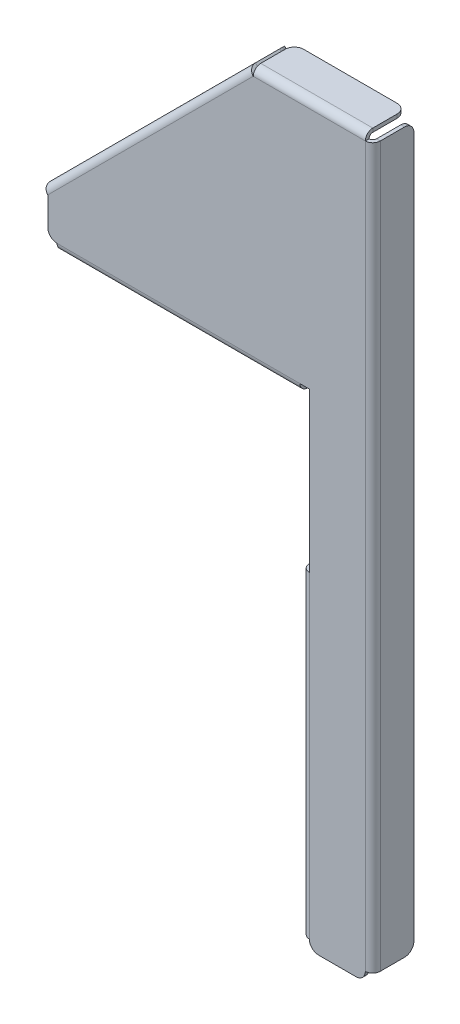
from build123d import *

# Parameters (mm, degrees)
BASE_FLANGE1_DEPTH    = 1
EDGE_FLANGE2_DEPTH    = 85
EDGE_FLANGE3_DEPTH    = 192.5
EDGE_FLANGE1_DEPTH    = 65
EDGE_FLANGE4_DEPTH    = 77.781745931
EDGE_FLANGE5_DEPTH    = 30
BREAK_CORNER1_START   = 128
BREAK_CORNER1_DEPTH   = 69
BREAK_CORNER1_START_2 = 196
BREAK_CORNER1_2_DEPTH = 1
BREAK_CORNER1_START_3 = -150.492424049
BREAK_CORNER1_3_DEPTH = 1
BREAK_CORNER1_START_4 = -2
BREAK_CORNER1_4_DEPTH = 19
BREAK_CORNER1_START_5 = 16
BREAK_CORNER1_5_DEPTH = 1
BREAK_CORNER1_6_DEPTH = 1
BREAK_CORNER1_START_6 = -1
BREAK_CORNER1_7_DEPTH = 1
CUT_EXTRUDE1_REACH    = 150.327


# Read off the part's stored shape, not the designer's step: Break-Corner1
# Sheet-metal steps are written as plain solids
with BuildPart() as part:
    # Sketch1 → Base-Flange1 (new body)
    with BuildSketch(Plane.XY):
        Polygon((0, 130), (-70, 130), (-70, 140), (-15, 195), (15, 195), (15, 130), (15, 0), (0, 0), align=None)
    extrude(amount=-BASE_FLANGE1_DEPTH)

    # Edge-Flange2 section (across the edge) → Edge-Flange2 (add)
    with BuildSketch(Plane(origin=(-1, 2.5, -1), x_dir=(1, 0, 0), z_dir=(0, 1, 0))):
        with BuildLine():
            Line((-1, 1), (-1, 12))
            Line((-1, 12), (0, 12))
            Line((0, 12), (0, 1))
            ThreePointArc((0, 1), (0.292893219, 0.292893219), (1, 0))
            Line((1, 0), (1, -1))
            ThreePointArc((1, -1), (-0.414213562, -0.414213562), (-1, 1))
        make_face()
    extrude(amount=EDGE_FLANGE2_DEPTH)

    # Edge-Flange3 section (across the edge) → Edge-Flange3 (add)
    with BuildSketch(Plane(origin=(16, 195, -1), x_dir=(-1, 0, 0), z_dir=(0, -1, 0))):
        with BuildLine():
            Line((-1, 1), (-1, 10))
            Line((-1, 10), (0, 10))
            Line((0, 10), (0, 1))
            ThreePointArc((0, 1), (0.292893219, 0.292893219), (1, 0))
            Line((1, 0), (1, -1))
            ThreePointArc((1, -1), (-0.414213562, -0.414213562), (-1, 1))
        make_face()
    extrude(amount=EDGE_FLANGE3_DEPTH)

    # Edge-Flange1 section (across the edge) → Edge-Flange1 (add)
    with BuildSketch(Plane(origin=(-2.5, 129, -1), x_dir=(0, 1, 0), z_dir=(-1, 0, 0))):
        with BuildLine():
            Line((-1, 1), (-1, 15.122069622))
            Line((-1, 15.122069622), (0, 15.122069622))
            Line((0, 15.122069622), (0, 1))
            ThreePointArc((0, 1), (0.292893219, 0.292893219), (1, 0))
            Line((1, 0), (1, -1))
            ThreePointArc((1, -1), (-0.414213562, -0.414213562), (-1, 1))
        make_face()
    extrude(amount=EDGE_FLANGE1_DEPTH)

    # Edge-Flange4 section (across the edge) → Edge-Flange4 (add)
    with BuildSketch(Plane(origin=(-70.707106781, 140.707106781, -1), x_dir=(0.7071067811865439, -0.7071067811865512, -3.4914813388431337e-15), z_dir=(0.7071067811865512, 0.7071067811865439, 0))):
        with BuildLine():
            Line((-1, 1), (-1, 10))
            Line((-1, 10), (0, 10))
            Line((0, 10), (0, 1))
            ThreePointArc((0, 1), (0.292893219, 0.292893219), (1, 0))
            Line((1, 0), (1, -1))
            ThreePointArc((1, -1), (-0.414213562, -0.414213562), (-1, 1))
        make_face()
    extrude(amount=EDGE_FLANGE4_DEPTH)

    # Edge-Flange5 section (across the edge) → Edge-Flange5 (add)
    with BuildSketch(Plane(origin=(-15, 196, -1), x_dir=(0, -1, 0), z_dir=(1, 0, 0))):
        with BuildLine():
            Line((-1, 1), (-1, 10))
            Line((-1, 10), (0, 10))
            Line((0, 10), (0, 1))
            ThreePointArc((0, 1), (0.292893219, 0.292893219), (1, 0))
            Line((1, 0), (1, -1))
            ThreePointArc((1, -1), (-0.414213562, -0.414213562), (-1, 1))
        make_face()
    extrude(amount=EDGE_FLANGE5_DEPTH)

    # Break-Corner1 outline → Break-Corner1 (cut)
    with BuildSketch(Plane(origin=(0, 0, 0), x_dir=(1, 0, 0), z_dir=(0, 1, 0)).offset(BREAK_CORNER1_START)):
        with BuildLine():
            ThreePointArc((-67.5, 13.622069622), (-66.767766953, 15.389836575), (-65, 16.122069622))
            Line((-65, 16.122069622), (-67.5, 16.122069622))
            Line((-67.5, 16.122069622), (-67.5, 13.622069622))
        make_face()
        with BuildLine():
            ThreePointArc((-5, 16.122069622), (-3.232233047, 15.389836575), (-2.5, 13.622069622))
            Line((-2.5, 13.622069622), (-2.5, 16.122069622))
            Line((-2.5, 16.122069622), (-5, 16.122069622))
        make_face()
        with BuildLine():
            Line((15, 11), (12.5, 11))
            ThreePointArc((12.5, 11), (14.267766953, 10.267766953), (15, 8.5))
            Line((15, 8.5), (15, 11))
        make_face()
    extrude(amount=BREAK_CORNER1_DEPTH, mode=Mode.SUBTRACT)

    # Break-Corner1 2 outline → Break-Corner1 2 (cut)
    with BuildSketch(Plane(origin=(0, 0, 0), x_dir=(1, 0, 0), z_dir=(0, 1, 0)).offset(BREAK_CORNER1_START_2)):
        with BuildLine():
            Line((-15, 11), (-15, 8.5))
            ThreePointArc((-15, 8.5), (-14.267766953, 10.267766953), (-12.5, 11))
            Line((-12.5, 11), (-15, 11))
        make_face()
    extrude(amount=BREAK_CORNER1_2_DEPTH, mode=Mode.SUBTRACT)

    # Break-Corner1 3 outline → Break-Corner1 3 (cut)
    with BuildSketch(Plane(origin=(0, 0, 0), x_dir=(0.7071067811865509, 0.707106781186544, 0), z_dir=(0.707106781186544, -0.707106781186551, 0)).offset(BREAK_CORNER1_START_3)):
        with BuildLine():
            Line((49.497474683, -11), (51.997474683, -11))
            ThreePointArc((51.997474683, -11), (50.22970773, -10.267766953), (49.497474683, -8.5))
            Line((49.497474683, -8.5), (49.497474683, -11))
        make_face()
        with BuildLine():
            ThreePointArc((127.279220614, -8.5), (126.546987567, -10.267766953), (124.779220614, -11))
            Line((124.779220614, -11), (127.279220614, -11))
            Line((127.279220614, -11), (127.279220614, -8.5))
        make_face()
    extrude(amount=BREAK_CORNER1_3_DEPTH, mode=Mode.SUBTRACT)

    # Break-Corner1 4 outline → Break-Corner1 4 (cut)
    with BuildSketch(Plane.YZ.offset(BREAK_CORNER1_START_4)):
        with BuildLine():
            ThreePointArc((195, -8.5), (194.267766953, -10.267766953), (192.5, -11))
            Line((192.5, -11), (195, -11))
            Line((195, -11), (195, -8.5))
        make_face()
        with BuildLine():
            ThreePointArc((87.449489743, -11), (86.58113883, -12.436491673), (85, -13))
            Line((85, -13), (87.5, -13))
            Line((87.5, -13), (87.5, -11))
            Line((87.5, -11), (87.449489743, -11))
        make_face()
        with BuildLine():
            Line((2.5, -13), (5, -13))
            ThreePointArc((5, -13), (3.232233047, -12.267766953), (2.5, -10.5))
            Line((2.5, -10.5), (2.5, -13))
        make_face()
    extrude(amount=BREAK_CORNER1_4_DEPTH, mode=Mode.SUBTRACT)

    # Break-Corner1 5 outline → Break-Corner1 5 (cut)
    with BuildSketch(Plane.YZ.offset(BREAK_CORNER1_START_5)):
        with BuildLine():
            Line((2.550510257, -11), (5, -11))
            ThreePointArc((5, -11), (3.232233047, -10.267766953), (2.5, -8.5))
            Line((2.5, -8.5), (2.5, -10.5))
            ThreePointArc((2.5, -10.5), (2.512659617, -10.751272405), (2.550510257, -11))
        make_face()
    extrude(amount=BREAK_CORNER1_5_DEPTH, mode=Mode.SUBTRACT)

    # Break-Corner1 6 outline → Break-Corner1 6 (cut)
    with BuildSketch(Plane.YZ.offset(BREAK_CORNER1_START_4)):
        with BuildLine():
            ThreePointArc((87.5, -10.5), (87.487340383, -10.751272405), (87.449489743, -11))
            Line((87.449489743, -11), (87.5, -11))
            Line((87.5, -11), (87.5, -10.5))
        make_face()
    extrude(amount=BREAK_CORNER1_6_DEPTH, mode=Mode.SUBTRACT)

    # Break-Corner1 7 outline → Break-Corner1 7 (cut)
    with BuildSketch(Plane.XY.offset(BREAK_CORNER1_START_6)):
        with BuildLine():
            ThreePointArc((-67.5, 130), (-69.267766953, 130.732233047), (-70, 132.5))
            Line((-70, 132.5), (-70, 130))
            Line((-70, 130), (-67.5, 130))
        make_face()
        with BuildLine():
            Line((0, 0), (2.5, 0))
            ThreePointArc((2.5, 0), (0.732233047, 0.732233047), (0, 2.5))
            Line((0, 2.5), (0, 0))
        make_face()
        with BuildLine():
            ThreePointArc((15, 2.5), (14.267766953, 0.732233047), (12.5, 0))
            Line((12.5, 0), (15, 0))
            Line((15, 0), (15, 2.5))
        make_face()
    extrude(amount=BREAK_CORNER1_7_DEPTH, mode=Mode.SUBTRACT)

    # Sketch15 → Cut-Extrude1 (cut, up to next)
    with BuildSketch(Plane(origin=(0, 129, 0), x_dir=(1, 0, 0), z_dir=(0, 1, 0)), mode=Mode.PRIVATE) as cut_extrude1_sk1:
        with BuildLine():
            Line((-60, 10.872069622), (-10, 10.872069622))
            ThreePointArc((-10, 10.872069622), (-8.25, 9.122069622), (-10, 7.372069622))
            Line((-10, 7.372069622), (-60, 7.372069622))
            ThreePointArc((-60, 7.372069622), (-61.75, 9.122069622), (-60, 10.872069622))
        make_face()
    cut_extrude1_tool1 = extrude(cut_extrude1_sk1.sketch, amount=-CUT_EXTRUDE1_REACH, mode=Mode.PRIVATE) & part.part
    add(cut_extrude1_tool1.solids().sort_by_distance((-35, 129, -9.12207))[0], mode=Mode.SUBTRACT)


solid = part.part
